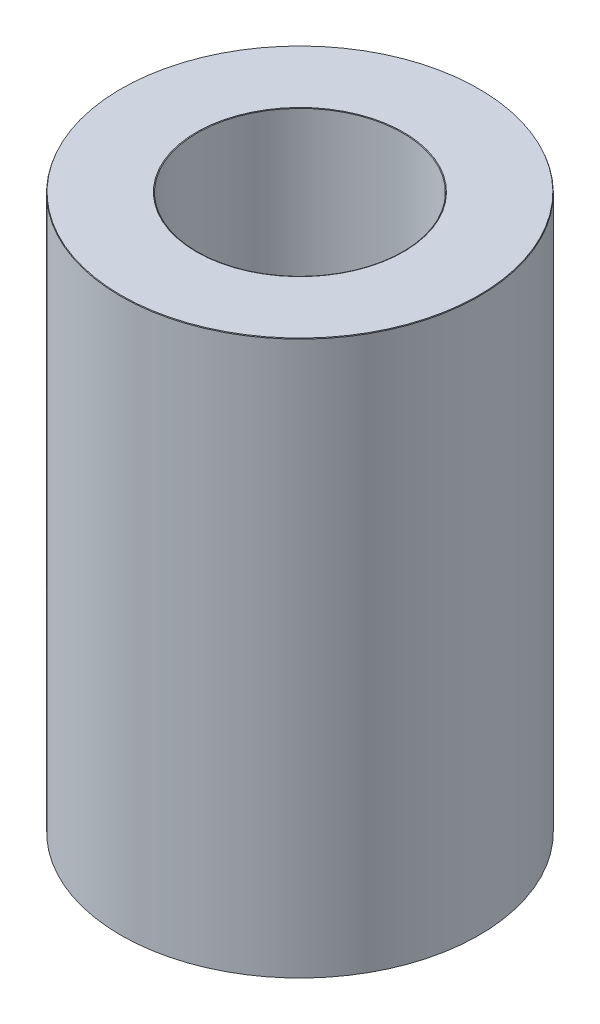
from build123d import *
from OCP.BRepFilletAPI import BRepFilletAPI_MakeChamfer

# Parameters (mm, degrees)
SKETCH1_R           = 55
BOSS_EXTRUDE1_DEPTH = 170.16211108
SKETCH2_R           = 31.580299908
CUT_EXTRUDE1_DEPTH  = 188.096616878
CHAMFER1_SIZE       = 0.22782666
CHAMFER1_SIZE2      = 0.098184782


with BuildPart() as part:
    # Sketch1 → Boss-Extrude1 (new body)
    with BuildSketch(Plane(origin=(0, 0, 0), x_dir=(1, 0, 0), z_dir=(0, 1, 0))):
        Circle(SKETCH1_R)
    extrude(amount=BOSS_EXTRUDE1_DEPTH)

    # Sketch2 → Cut-Extrude1 (cut, through all)
    with BuildSketch(Plane(origin=(0, 0, 0), x_dir=(1, 0, 0), z_dir=(0, 1, 0))):
        Circle(SKETCH2_R)
    extrude(amount=CUT_EXTRUDE1_DEPTH, mode=Mode.SUBTRACT)

    # Chamfer1: one chamfer whose edges measure the first distance from different faces: ONE call of the kernel's chamfer builder (chamfer() names one face for all edges)
    chamfer1_edges_1 = [part.edges().sort_by_distance(p)[0] for p in [
        (-31.580299908, 170.16211108, 0),
    ]]
    chamfer1_side_1 = [part.faces().sort_by_distance(p)[0] for p in [
        (-53.444365081, 170.16211108, 0),
    ]]
    chamfer1_edges_2 = [part.edges().sort_by_distance(p)[0] for p in [
        (-31.580299908, 0, 0),
    ]]
    chamfer1_side_2 = [part.faces().sort_by_distance(p)[0] for p in [
        (-31.580299908, 85.08105554, 0),
    ]]
    chamfer1_edges_3 = [part.edges().sort_by_distance(p)[0] for p in [
        (-55, 0, 0),
    ]]
    chamfer1_side_3 = [part.faces().sort_by_distance(p)[0] for p in [
        (-53.444365081, 0, 0),
    ]]
    chamfer1_edges_4 = [part.edges().sort_by_distance(p)[0] for p in [
        (-55, 170.16211108, 0),
    ]]
    chamfer1_side_4 = [part.faces().sort_by_distance(p)[0] for p in [
        (-55, 85.08105554, 0),
    ]]
    chamfer1 = BRepFilletAPI_MakeChamfer(part.part.solid().wrapped)
    for e in chamfer1_edges_1:
        chamfer1.Add(CHAMFER1_SIZE, CHAMFER1_SIZE2, e.wrapped, chamfer1_side_1[0].wrapped)  # the first distance lies on this face
    for e in chamfer1_edges_2:
        chamfer1.Add(CHAMFER1_SIZE, CHAMFER1_SIZE2, e.wrapped, chamfer1_side_2[0].wrapped)  # the first distance lies on this face
    for e in chamfer1_edges_3:
        chamfer1.Add(CHAMFER1_SIZE, CHAMFER1_SIZE2, e.wrapped, chamfer1_side_3[0].wrapped)  # the first distance lies on this face
    for e in chamfer1_edges_4:
        chamfer1.Add(CHAMFER1_SIZE, CHAMFER1_SIZE2, e.wrapped, chamfer1_side_4[0].wrapped)  # the first distance lies on this face
    add(Compound.cast(chamfer1.Shape()), mode=Mode.REPLACE)


solid = part.part
